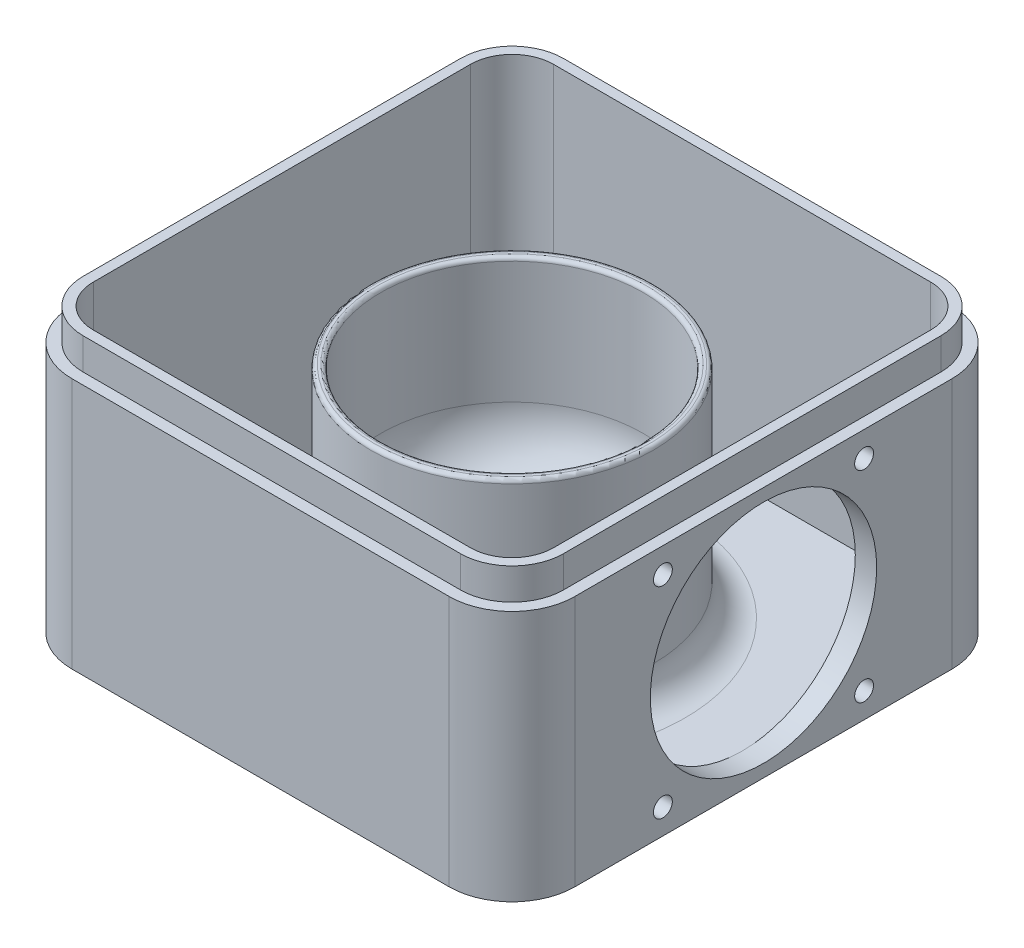
from build123d import *

# Parameters (mm, degrees)
SKETCH1_W                = 80
SKETCH1_H                = 80
BOSS_EXTRUDE1_DEPTH      = 40
FILLET1_R                = 10
BOSS_EXTRUDE5_DEPTH      = 5
CUT_EXTRUDE6_DEPTH       = 43
SKETCH8_R                = 22.5
BOSS_EXTRUDE4_DEPTH      = 35
SKETCH9_R                = 20.900000000000002
CUT_EXTRUDE5_DEPTH       = 30
FILLET2_R                = 10
CUT_FAN_REACH            = 102.125
SKETCH10_R               = 18
SKETCH10_R_2             = 1.5000000000000007
SKETCH10_R_3             = 1.5000000000000009
FILLET3_R                = 5
FILLET5_R                = 0.6
CUT_EXTRUDE10_DEPTH      = 8
CUT_EXTRUDE10_DEPTH_BACK = 8
FILLET10_R               = 5
FILLET9_R                = 1


with BuildPart() as part:
    # Sketch1 → Boss-Extrude1 (new body)
    with BuildSketch(Plane(origin=(0, 0, 0), x_dir=(1, 0, 0), z_dir=(0, 1, 0))):
        Rectangle(SKETCH1_W, SKETCH1_H)
    extrude(amount=BOSS_EXTRUDE1_DEPTH)

    # Fillet1
    fillet1_edges = [part.edges().sort_by_distance(p)[0] for p in [
        (40, 20, 40),
        (-40, 20, 40),
        (-40, 20, -40.00000000000001),
        (40, 20, -40.00000000000001),
    ]]
    fillet(fillet1_edges, radius=FILLET1_R)

    # 3DSketch4 → Boss-Extrude5 (add)
    with BuildSketch(Plane(origin=(-38.199999999999996, 40, -30.000000000000007), x_dir=(0.786461199740678, 0, 0.6176396856602184), z_dir=(0, 1, 0))):
        with BuildLine():
            Line((0, 0), (37.058381139613104, -47.187671984440684))
            ThreePointArc((37.058381139613104, -47.187671984440684), (42.52848931067159, -50.264390473830375), (48.57200839990046, -48.572008399900454))
            Line((48.57200839990046, -48.572008399900454), (95.75968038434114, -11.513627260287345))
            ThreePointArc((95.75968038434114, -11.513627260287345), (98.83639887373083, -6.043519089228864), (97.1440167998009, 0))
            Line((97.1440167998009, 0), (60.08563566018779, 47.187671984440684))
            ThreePointArc((60.08563566018779, 47.187671984440684), (54.61552748912932, 50.26439047383036), (48.572008399900454, 48.57200839990046))
            Line((48.572008399900454, 48.57200839990046), (1.3843364154597682, 11.513627260287349))
            ThreePointArc((1.3843364154597682, 11.513627260287349), (-1.6923820739299176, 6.0435190892288695), (0, 0))
        make_face()
    extrude(amount=BOSS_EXTRUDE5_DEPTH)

    # 3DSketch5 → Cut-Extrude6 (cut)
    with BuildSketch(Plane(origin=(-36.6, 45.00000000000001, -30.00000000000001), x_dir=(0.7733921049602126, 0, 0.6339279548854203), z_dir=(0, 1, 0))):
        with BuildLine():
            Line((0, 0), (38.03567729312523, -46.40352629761277))
            ThreePointArc((38.03567729312523, -46.40352629761277), (42.489199280610634, -48.78743047563925), (47.3239896881064, -47.32398968810639))
            Line((47.3239896881064, -47.32398968810639), (93.72751598571915, -9.288312394981173))
            ThreePointArc((93.72751598571915, -9.288312394981173), (96.11142016374562, -4.834790407495783), (94.64797937621279, 0))
            Line((94.64797937621279, 0), (56.612302083087584, 46.40352629761277))
            ThreePointArc((56.612302083087584, 46.40352629761277), (52.158780095602175, 48.78743047563926), (47.32398968810639, 47.323989688106394))
            Line((47.32398968810639, 47.323989688106394), (0.9204633904936338, 9.28831239498118))
            ThreePointArc((0.9204633904936338, 9.28831239498118), (-1.4634407875328472, 4.834790407495782), (0, 0))
        make_face()
    extrude(amount=-CUT_EXTRUDE6_DEPTH, mode=Mode.SUBTRACT)

    # Sketch8 → Boss-Extrude4 (add)
    with BuildSketch(Plane(origin=(0, 2.0000000000000018, 0), x_dir=(1, 0, 0), z_dir=(0, 1, 0))):
        with Locations(Location((0, 0, 0), (0, 0, 90))):
            Circle(SKETCH8_R)
    extrude(amount=BOSS_EXTRUDE4_DEPTH)

    # Sketch9 → Cut-Extrude5 (cut)
    with BuildSketch(Plane(origin=(0, 37.00000000000001, 0), x_dir=(1, 0, 0), z_dir=(0, 1, 0))):
        with Locations(Location((0, 0, 0), (0, 0, 270))):
            Circle(SKETCH9_R)
    extrude(amount=-CUT_EXTRUDE5_DEPTH, mode=Mode.SUBTRACT)

    # Fillet2
    fillet2_edges = [part.edges().sort_by_distance(p)[0] for p in [
        (1.568e-14, 7.000000000000007, -20.900000000000002),
    ]]
    fillet(fillet2_edges, radius=FILLET2_R)

    # Sketch10 → Cut-Fan (cut, up to next)
    with BuildSketch(Plane(origin=(40, 0, 0), x_dir=(0, 0, -1), z_dir=(1, 0, 0)), mode=Mode.PRIVATE) as cut_fan_sk1:
        with Locations((-1.3e-15, 20)):
            Circle(SKETCH10_R)
    cut_fan_tool1 = extrude(cut_fan_sk1.sketch, amount=-CUT_FAN_REACH, mode=Mode.PRIVATE) & part.part
    # Sketch10 → Cut-Fan (cut, up to next)
    with BuildSketch(Plane(origin=(40, 0, 0), x_dir=(0, 0, -1), z_dir=(1, 0, 0)), mode=Mode.PRIVATE) as cut_fan_sk2:
        with Locations((16, 4.0000000000000036)):
            Circle(SKETCH10_R_2)
    cut_fan_tool2 = extrude(cut_fan_sk2.sketch, amount=-CUT_FAN_REACH, mode=Mode.PRIVATE) & part.part
    # Sketch10 → Cut-Fan (cut, up to next)
    with BuildSketch(Plane(origin=(40, 0, 0), x_dir=(0, 0, -1), z_dir=(1, 0, 0)), mode=Mode.PRIVATE) as cut_fan_sk3:
        with Locations(Location((-16.000000000000007, 4.0000000000000036, 0), (0, 0, 180))):
            Circle(SKETCH10_R_2)
    cut_fan_tool3 = extrude(cut_fan_sk3.sketch, amount=-CUT_FAN_REACH, mode=Mode.PRIVATE) & part.part
    # Sketch10 → Cut-Fan (cut, up to next)
    with BuildSketch(Plane(origin=(40, 0, 0), x_dir=(0, 0, -1), z_dir=(1, 0, 0)), mode=Mode.PRIVATE) as cut_fan_sk4:
        with Locations((-15.999999999999979, 36)):
            Circle(SKETCH10_R_3)
    cut_fan_tool4 = extrude(cut_fan_sk4.sketch, amount=-CUT_FAN_REACH, mode=Mode.PRIVATE) & part.part
    # Sketch10 → Cut-Fan (cut, up to next)
    with BuildSketch(Plane(origin=(40, 0, 0), x_dir=(0, 0, -1), z_dir=(1, 0, 0)), mode=Mode.PRIVATE) as cut_fan_sk5:
        with Locations(Location((16.000000000000007, 36, 0), (0, 0, 180))):
            Circle(SKETCH10_R_3)
    cut_fan_tool5 = extrude(cut_fan_sk5.sketch, amount=-CUT_FAN_REACH, mode=Mode.PRIVATE) & part.part
    add(cut_fan_tool1.solids().sort_by_distance((40, 20, 0))[0], mode=Mode.SUBTRACT)
    add(cut_fan_tool2.solids().sort_by_distance((40, 4, -16))[0], mode=Mode.SUBTRACT)
    add(cut_fan_tool3.solids().sort_by_distance((40, 4, 16))[0], mode=Mode.SUBTRACT)
    add(cut_fan_tool4.solids().sort_by_distance((40, 36, 16))[0], mode=Mode.SUBTRACT)
    add(cut_fan_tool5.solids().sort_by_distance((40, 36, -16))[0], mode=Mode.SUBTRACT)

    # Fillet3
    fillet3_edges = [part.edges().sort_by_distance(p)[0] for p in [
        (-4.13e-15, 2.0000000000000018, 22.5),
    ]]
    fillet(fillet3_edges, radius=FILLET3_R)

    # Fillet5
    fillet5_edges = [part.edges().sort_by_distance(p)[0] for p in [
        (-4.13e-15, 37, 22.5),
        (1.568e-14, 37.00000000000001, -20.900000000000002),
    ]]
    fillet(fillet5_edges, radius=FILLET5_R)

    # Sketch12 → Cut-Extrude10 (cut, two sides: drawn at the far end of the back side and taken through both)
    with BuildSketch(Plane.XZ.offset(-2.0000000000000018).offset(-CUT_EXTRUDE10_DEPTH_BACK)):
        Polygon((-36.6, 22.500000000000007), (-26.6, 22.500000000000007), (-26.6, -22.499999999999993), (-36.6, -22.500000000000007), align=None)
    extrude(amount=CUT_EXTRUDE10_DEPTH + CUT_EXTRUDE10_DEPTH_BACK, mode=Mode.SUBTRACT)

    # Fillet10
    fillet10_edges = [part.edges().sort_by_distance(p)[0] for p in [
        (-36.6, 1.0000000000000036, 22.500000000000007),
        (-36.6, 1.0000000000000036, -22.500000000000007),
        (-26.6, 1.0000000000000036, 22.500000000000007),
        (-26.6, 1.0000000000000036, -22.499999999999993),
    ]]
    fillet(fillet10_edges, radius=FILLET10_R - 0.0001)  # a hair under: the kernel refuses the full size

    # Fillet9
    fillet9_edges = [part.edges().sort_by_distance(p)[0] for p in [
        (-36.6, 0, 1.78e-15),
        (-26.6, 0, 7.11e-15),
        (-35.13556319525462, 0, 21.035563195254625),
        (-35.13556319525462, 0, -21.03556319525462),
        (-28.06443680474538, 0, 21.035563195254625),
        (-28.06443680474538, 0, -21.035563195254614),
    ]]
    fillet(fillet9_edges, radius=FILLET9_R)


solid = part.part
